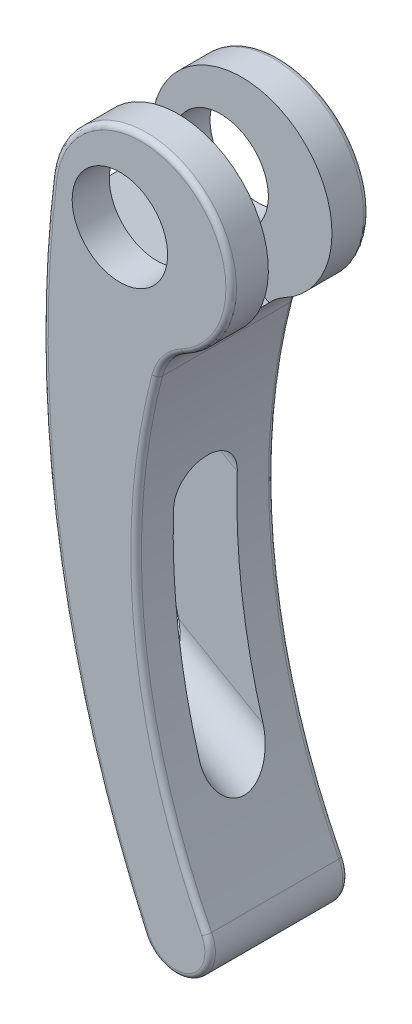
from build123d import *

# Parameters (mm, degrees)
SKETCH1_R              = 4.5
BOSS_EXTRUDE1_DEPTH    = 6.5
CUT_EXTRUDE2_START     = -6.767949192
CUT_EXTRUDE2_OUTLINE_W = 16.196152423
CUT_EXTRUDE2_OUTLINE_H = 6
CUT_EXTRUDE2_DEPTH     = 37.025615725
FILLET1_R              = 0.5


with BuildPart() as part:
    # Sketch1 → Boss-Extrude1 (new, symmetric)
    with BuildSketch(Plane.XY):
        with BuildLine():
            ThreePointArc((6, -7.5), (6.815964166, 7.004033777), (-6.434872644, 1.050201636))
            ThreePointArc((-6.434872644, 1.050201636), (-6.050998417, -28.363958478), (2.273030164, -56.578329336))
            ThreePointArc((2.273030164, -56.578329336), (6.659428942, -58.179125447), (8.157483328, -53.756583701))
            ThreePointArc((8.157483328, -53.756583701), (1.87855052, -32.627427824), (3.51582406, -10.645945603))
            ThreePointArc((3.51582406, -10.645945603), (4.428851728, -8.813132427), (6, -7.5))
        make_face()
        with Locations(Location((0, 0, 0), (0, 0, 180))):
            Circle(SKETCH1_R, mode=Mode.SUBTRACT)
    extrude(amount=BOSS_EXTRUDE1_DEPTH, both=True)

    # Cut-Extrude2: read off the stored shape, not the designer's step
    # Cut-Extrude2 outline → Cut-Extrude2 (cut)
    with BuildSketch(Plane(origin=(0, 0, 0), x_dir=(0.49999999999999817, 0.8660254037844398, 0), z_dir=(0.8660254037844398, -0.49999999999999784, 0)).offset(CUT_EXTRUDE2_START)):
        with BuildLine():
            Line((-35.507041555, -3), (-19.918584287, -3))
            add(Edge.make_bspline(
                [(-19.918584287, -3), (-17.320508076, -3), (-17.320508076, 0), (-17.320508076, 3), (-19.918584287, 3)],
                knots=[0, 0, 0, 1.570796327, 1.570796327, 3.141592654, 3.141592654, 3.141592654], degree=2, weights=[1, 0.707106781, 1, 0.707106781, 1]))
            Line((-19.918584287, 3), (-35.507041555, 3))
            add(Edge.make_bspline(
                [(-35.507041555, 3), (-38.105117767, 3), (-38.105117767, 0), (-38.105117767, -3), (-35.507041555, -3)],
                knots=[3.141592654, 3.141592654, 3.141592654, 4.71238898, 4.71238898, 6.283185307, 6.283185307, 6.283185307], degree=2, weights=[1, 0.707106781, 1, 0.707106781, 1]))
        make_face()
        with Locations((2.901923788, 0)):
            Rectangle(CUT_EXTRUDE2_OUTLINE_W, CUT_EXTRUDE2_OUTLINE_H)
    extrude(amount=CUT_EXTRUDE2_DEPTH, mode=Mode.SUBTRACT)

    # Fillet1
    fillet1_edges = [part.edges().sort_by_distance(p)[0] for p in [
        (-6.050998417, -28.363958478, 6.5),
        (6.659428942, -58.179125447, 6.5),
        (1.87855052, -32.627427824, 6.5),
        (4.428851728, -8.813132427, 6.5),
        (1.87855052, -32.627427824, -6.5),
        (6.659428942, -58.179125447, -6.5),
        (-6.050998417, -28.363958478, -6.5),
        (6.815964166, 7.004033777, -6.5),
        (4.428851728, -8.813132427, -6.5),
        (6.815964166, 7.004033777, 6.5),
    ]]
    fillet(fillet1_edges, radius=FILLET1_R)


solid = part.part
